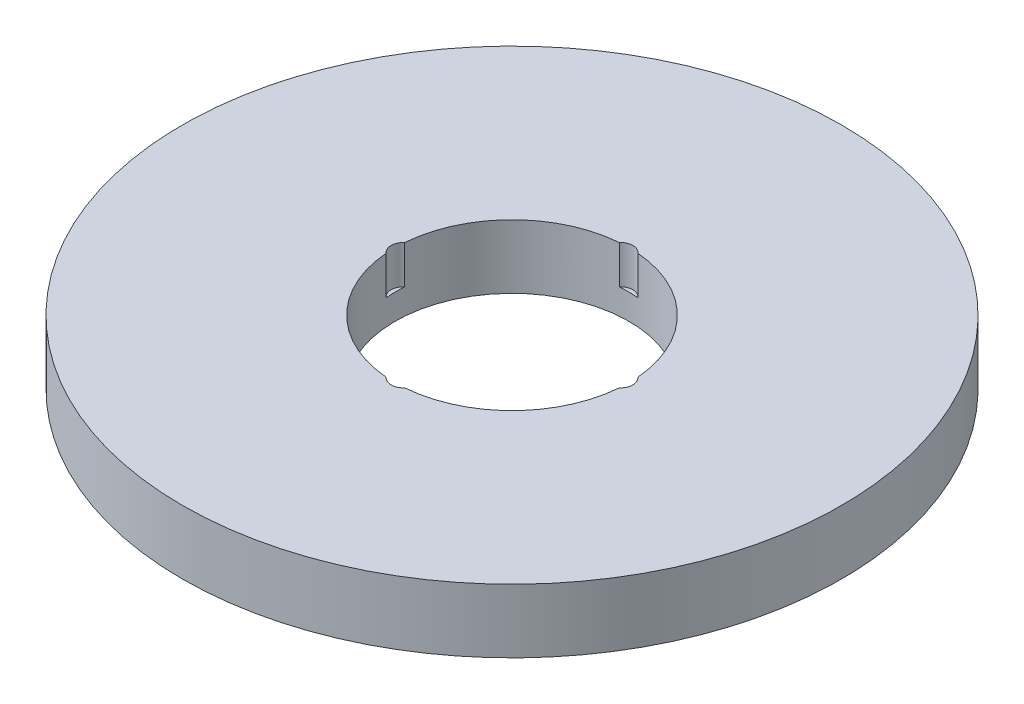
from build123d import *

# Parameters (mm, degrees)
SKETCH1_R           = 77.5
BOSS_EXTRUDE1_DEPTH = 15
SKETCH2_R           = 27.5
CUT_EXTRUDE1_DEPTH  = 111.623234449
SKETCH3_R           = 2.879190032
CUT_EXTRUDE2_DEPTH  = 9.039500984
CIRPATTERN1_COUNT   = 4


with BuildPart() as part:
    # Sketch1 → Boss-Extrude1 (new body)
    with BuildSketch(Plane(origin=(0, 0, 0), x_dir=(1, 0, 0), z_dir=(0, 1, 0))):
        Circle(SKETCH1_R)
    extrude(amount=BOSS_EXTRUDE1_DEPTH)

    # Sketch2 → Cut-Extrude1 (cut, through all)
    with BuildSketch(Plane(origin=(0, 0, 0), x_dir=(1, 0, 0), z_dir=(0, 1, 0))):
        Circle(SKETCH2_R)
    extrude(amount=CUT_EXTRUDE1_DEPTH, mode=Mode.SUBTRACT)

    # Sketch3 → Cut-Extrude2 (cut)
    with BuildSketch(Plane(origin=(0, 15, 0), x_dir=(1, 0, 0), z_dir=(0, 1, 0))):
        with Locations((-25.53928648, 0)):
            Circle(SKETCH3_R)
    cut_extrude2 = extrude(amount=-CUT_EXTRUDE2_DEPTH, mode=Mode.SUBTRACT)

    # CirPattern1: Cut-Extrude2 ×4 about axis
    cirpattern1_axis = Axis((0, 0, 0), (0, 1, 0))
    for i in range(1, CIRPATTERN1_COUNT):
        add(cut_extrude2.rotate(cirpattern1_axis, i * 360 / CIRPATTERN1_COUNT), mode=Mode.SUBTRACT)


solid = part.part
